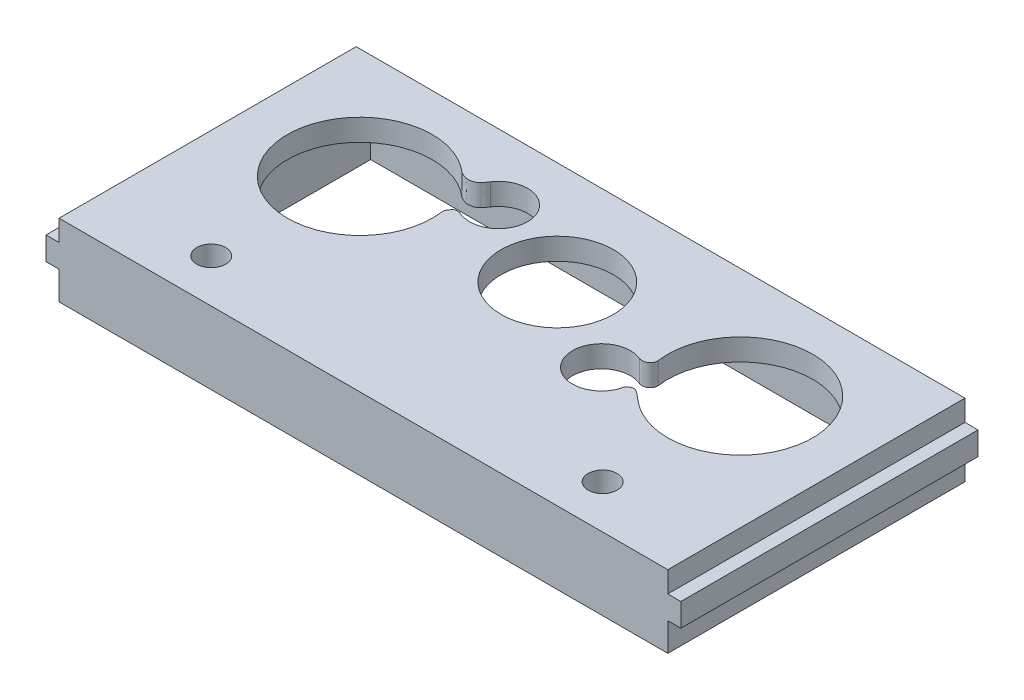
from build123d import *

# Parameters (mm, degrees)
SKETCH1_W                   = 75
SKETCH1_H                   = 26.5
BASE_01_DEPTH               = 10
SKETCH4_R                   = 7.75
SKETCH4_R_2                 = 10
SKETCH4_R_3                 = 4
CAMERA_LIGHTS_DEPTH         = 42.00990734
SKETCH5_W                   = 75
SKETCH5_H                   = 10
UPPER_SIDE_SUPPORT_DEPTH    = 5
SKETCH6_W                   = 31.5
SKETCH6_H                   = 10
LEFT_SIDE_SUPPORT_DEPTH     = 4.5
SKETCH7_W                   = 31.5
SKETCH7_H                   = 10
RIGHT_SIDE_SUPPORT_DEPTH    = 4.5
SKETCH8_W                   = 75
SKETCH8_H                   = 2.5
BASE_01_CUT_DEPTH           = 7
SKETCH10_W                  = 31.5
SKETCH10_H                  = 3.2
LEFT_SIDE_BODY_HOLDER_DEPTH = 1.8
LOWER_BASE_SUPPORT_DEPTH    = 9.5
SKETCH12_W                  = 25.5
SKETCH12_H                  = 7
CAMERA_WIRE_EXT_CUT_DEPTH   = 1.5
SKETCH13_R                  = 2
CAMERA_HOLDING_HOLES_DEPTH  = 51.35873807
IR_START                    = -3
IR_FIT_CUT_DEPTH            = 3
IR_FIT_CUT_2_DEPTH          = 3


# Read off the part's stored shape, not the designer's step: IR Fit Cut
with BuildPart() as part:
    # Sketch1 → Base 01 (new body)
    with BuildSketch(Plane(origin=(0, 0, 0), x_dir=(1, 0, 0), z_dir=(0, 1, 0))):
        Rectangle(SKETCH1_W, SKETCH1_H)
    extrude(amount=BASE_01_DEPTH)

    # Sketch4 → Camera & lights (cut, through all)
    with BuildSketch(Plane(origin=(0, 10, 0), x_dir=(1, 0, 0), z_dir=(0, 1, 0))):
        with Locations(Location((0, 4, 0), (0, 0, 270))):
            Circle(SKETCH4_R)
        with Locations(Location((-26.25, 3, 0), (0, 0, 270))):
            Circle(SKETCH4_R_2)
        with Locations(Location((26.25, 3, 0), (0, 0, 90))):
            Circle(SKETCH4_R_2)
        with Locations(Location((-13.25, 9.15, 0), (0, 0, 270))):
            Circle(SKETCH4_R_3)
        with Locations(Location((13.25, -3.15, 0), (0, 0, 270))):
            Circle(SKETCH4_R_3)
    extrude(amount=-CAMERA_LIGHTS_DEPTH, mode=Mode.SUBTRACT)

    # Sketch5 → Upper side support (add)
    with BuildSketch(Plane(origin=(0, 0, -13.25), x_dir=(-1, 0, 0), z_dir=(0, 0, -1))):
        with Locations((0, 5)):
            Rectangle(SKETCH5_W, SKETCH5_H)
    extrude(amount=UPPER_SIDE_SUPPORT_DEPTH)

    # Sketch6 → Left Side Support (add)
    with BuildSketch(Plane.ZY.offset(37.5)):
        with Locations((-2.5, 5)):
            Rectangle(SKETCH6_W, SKETCH6_H)
    extrude(amount=LEFT_SIDE_SUPPORT_DEPTH)

    # Sketch7 → Right Side Support (add)
    with BuildSketch(Plane(origin=(37.5, 0, 0), x_dir=(0, 0, -1), z_dir=(1, 0, 0))):
        with Locations((2.5, 5)):
            Rectangle(SKETCH7_W, SKETCH7_H)
    extrude(amount=RIGHT_SIDE_SUPPORT_DEPTH)

    # Sketch8 → Base 01 Cut (cut)
    with BuildSketch(Plane.XZ):
        with Locations((0, -14.5)):
            Rectangle(SKETCH8_W, SKETCH8_H)
        Polygon((-37.5, 10.25), (-37.5, -13.25), (37.5, -13.25), (37.5, 10.25), (12.75, 10.25), (12.75, 13.25), (-12.75, 13.25), (-12.75, 10.25), align=None)
    extrude(amount=-BASE_01_CUT_DEPTH, mode=Mode.SUBTRACT)

    # Sketch10 → Left Side body Holder (add)
    with BuildSketch(Plane.ZY.offset(42)):
        with Locations((-2.5, 5.5)):
            Rectangle(SKETCH10_W, SKETCH10_H)
    left_side_body_holder = extrude(amount=LEFT_SIDE_BODY_HOLDER_DEPTH)

    # Right Side body Holder: Left Side body Holder across plane
    add(left_side_body_holder.mirror(Plane(origin=(0, 0, 0), x_dir=(0, 0, 1), z_dir=(1, 0, 0))))

    # Sketch11 → Lower base support (add)
    with BuildSketch(Plane.XY.offset(13.25)):
        Polygon((42, 3.9), (43.8, 3.9), (43.8, 7.1), (42, 7.1), (42, 10), (-42, 10), (-42, 7.1), (-43.8, 7.1), (-43.8, 3.9), (-42, 3.9), (-42, 0), (-12.75, 0), (-12.75, 7), (12.75, 7), (12.75, 0), (42, 0), align=None)
    extrude(amount=LOWER_BASE_SUPPORT_DEPTH)

    # Sketch12 → Camera Wire Ext cut (add)
    with BuildSketch(Plane.XY.offset(22.75)):
        with Locations((0, 3.5)):
            Rectangle(SKETCH12_W, SKETCH12_H)
    extrude(amount=-CAMERA_WIRE_EXT_CUT_DEPTH)

    # Sketch13 → Camera Holding Holes (cut, through all)
    with BuildSketch(Plane.XZ):
        with Locations(Location((27, 16.75, 0), (0, 0, 270))):
            Circle(SKETCH13_R)
        with Locations(Location((-27, 16.75, 0), (0, 0, 270))):
            Circle(SKETCH13_R)
    extrude(amount=-CAMERA_HOLDING_HOLES_DEPTH, mode=Mode.SUBTRACT)

    # IR Fit Cut outline → IR Fit Cut (cut)
    with BuildSketch(Plane(origin=(0, 10, 0), x_dir=(1, 0, 0), z_dir=(0, 1, 0)).offset(IR_START)):
        with BuildLine():
            ThreePointArc((14.81661521, 0.530450623), (16.802776188, -1.31212586), (17.159118071, -3.99781832))
            add(Edge.make_bspline(
                [(17.159118071, -3.99781832), (17.166278119, -3.969934013), (17.178337476, -3.936891555), (17.246780801, -3.833932894), (17.305076574, -3.770665125), (17.4349321, -3.591329111), (17.910202533, -3.389398307), (18.485343295, -3.51410072), (19.253649785, -4.184734467), (19.696093453, -4.554177367), (19.740193994, -4.590943668)],
                knots=[0.275674193, 0.275674193, 0.275674193, 0.275674193, 0.290109149, 0.298316137, 0.344073007, 0.355594369, 0.407810154, 0.509906244, 0.719358573, 0.742631054, 0.742631054, 0.742631054, 0.742631054], degree=3))
            ThreePointArc((19.740193994, -4.590943668), (17.497995952, -1.83760531), (16.359278951, 1.525674007))
            add(Edge.make_bspline(
                [(14.81661521, 0.530450623), (15.181815782, 0.40272852), (15.86245956, 0.462037657), (16.265810628, 1.050757555), (16.365277346, 1.362969111), (16.359278951, 1.525674007)],
                knots=[0.222395894, 0.222395894, 0.222395894, 0.222395894, 0.382891887, 0.477494733, 0.530327084, 0.530327084, 0.530327084, 0.530327084], degree=3))
        make_face()
        with BuildLine():
            ThreePointArc((21.469612645, -5.783387543), (20.701388337, -5.319429584), (19.977853966, -4.788464812))
            add(Edge.make_bspline(
                [(19.977853966, -4.788464812), (20.110594541, -4.897809063), (20.298403446, -5.048291915), (20.760469103, -5.372959062), (21.111213366, -5.596213213), (21.469612645, -5.783387543)],
                knots=[0.784128545, 0.784128545, 0.784128545, 0.784128545, 0.852708708, 0.878445602, 1, 1, 1, 1], degree=3))
        make_face()
        with BuildLine():
            ThreePointArc((-19.618250253, 10.484643966), (-17.433842543, 7.71967877), (-16.344107974, 4.368686656))
            add(Edge.make_bspline(
                [(-16.344107974, 4.368686656), (-16.346786074, 4.400652489), (-16.363410494, 4.682682191), (-16.259037035, 4.912025365), (-16.023124853, 5.263934466), (-15.852731431, 5.462556558), (-15.60349989, 5.608912133), (-15.554028579, 5.614463051), (-15.094185027, 5.582253589), (-15.041983124, 5.573857318)],
                knots=[0.560427253, 0.560427253, 0.560427253, 0.560427253, 0.567434759, 0.623494809, 0.639172793, 0.708536611, 0.730178495, 0.833949751, 0.846921158, 0.846921158, 0.846921158, 0.846921158], degree=3))
            ThreePointArc((-15.041983124, 5.573857318), (-17.118345184, 8.132205554), (-16.569932259, 11.381154364))
            add(Edge.make_bspline(
                [(-19.618250253, 10.484643966), (-19.339728391, 10.325698426), (-18.991295195, 10.23044062), (-18.442190237, 10.020965988), (-17.459671267, 10.214555154), (-16.971941729, 10.950254946), (-17.098342068, 10.607973515), (-16.595700977, 11.343869746), (-16.569932259, 11.381154364)],
                knots=[0.533161585, 0.533161585, 0.533161585, 0.533161585, 0.632900245, 0.655820771, 0.750528398, 0.776212567, 0.886978295, 0.892604255, 0.892604255, 0.892604255, 0.892604255], degree=3))
        make_face()
    extrude(amount=IR_FIT_CUT_DEPTH, mode=Mode.SUBTRACT)

    # IR Fit Cut 2 outline → IR Fit Cut 2 (add)
    with BuildSketch(Plane(origin=(0, 10, 0), x_dir=(1, 0, 0), z_dir=(0, 1, 0)).offset(IR_START)):
        with BuildLine():
            add(Edge.make_bspline(
                [(19.740193994, -4.590943668), (19.76337103, -4.610266194), (19.841872549, -4.675657908), (19.921206817, -4.741802064), (19.977853966, -4.788464812)],
                knots=[0.742631054, 0.742631054, 0.742631054, 0.742631054, 0.754861905, 0.784128545, 0.784128545, 0.784128545, 0.784128545], degree=3))
            ThreePointArc((19.740193994, -4.590943668), (19.858260946, -4.690622333), (19.977853966, -4.788464812))
        make_face()
    extrude(amount=IR_FIT_CUT_2_DEPTH)


solid = part.part
